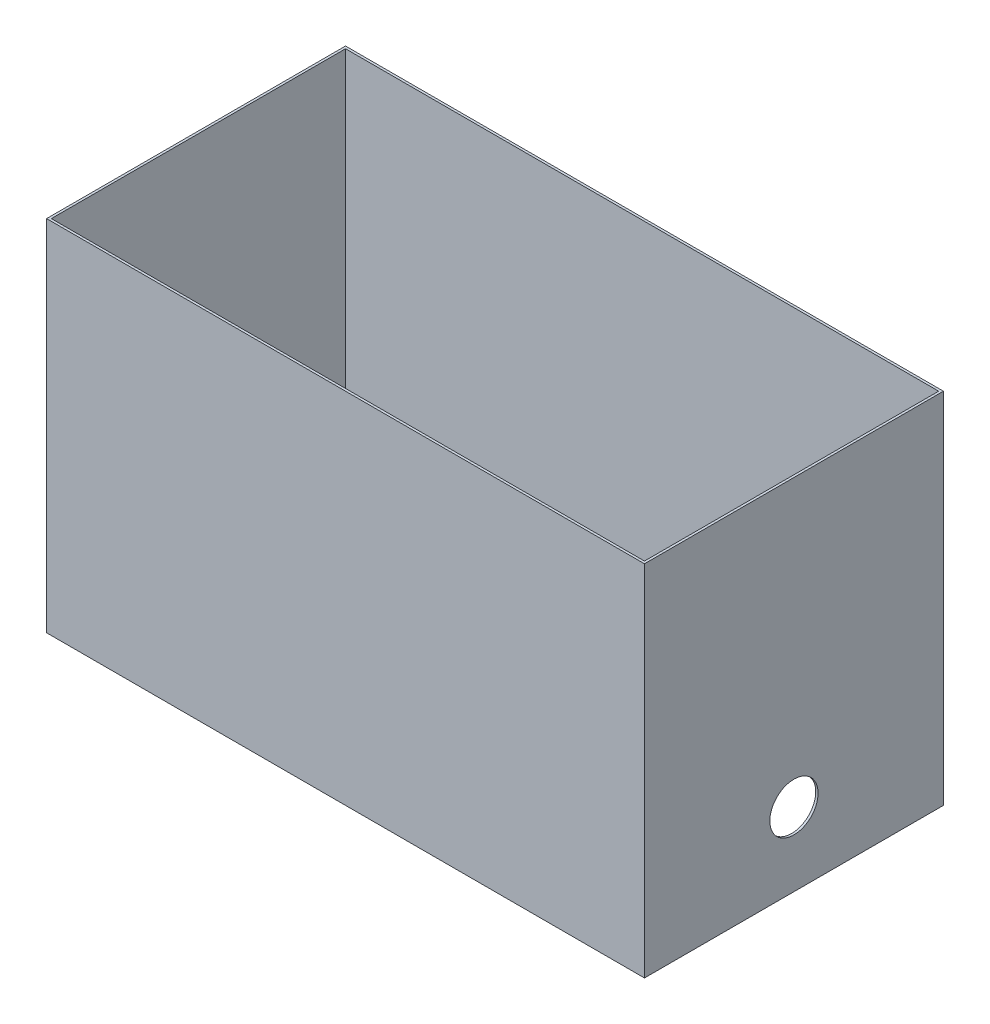
from build123d import *

# Parameters (mm, degrees)
SKETCH1_W           = 508
SKETCH1_H           = 254
SKETCH1_W_2         = 504
SKETCH1_H_2         = 250
BOSS_EXTRUDE1_DEPTH = 304.8
SKETCH2_R           = 20.5
CUT_EXTRUDE1_DEPTH  = 606.884510447


with BuildPart() as part:
    # Sketch1 → Boss-Extrude1 (new body)
    with BuildSketch(Plane(origin=(0, 0, 0), x_dir=(1, 0, 0), z_dir=(0, 1, 0))):
        Rectangle(SKETCH1_W, SKETCH1_H)
        Rectangle(SKETCH1_W_2, SKETCH1_H_2, mode=Mode.SUBTRACT)
    extrude(amount=BOSS_EXTRUDE1_DEPTH)

    # Sketch2 → Cut-Extrude1 (cut, through all)
    with BuildSketch(Plane.ZY.offset(254)):
        with Locations((0, 62.3)):
            Circle(SKETCH2_R)
    extrude(amount=-CUT_EXTRUDE1_DEPTH, mode=Mode.SUBTRACT)


solid = part.part
